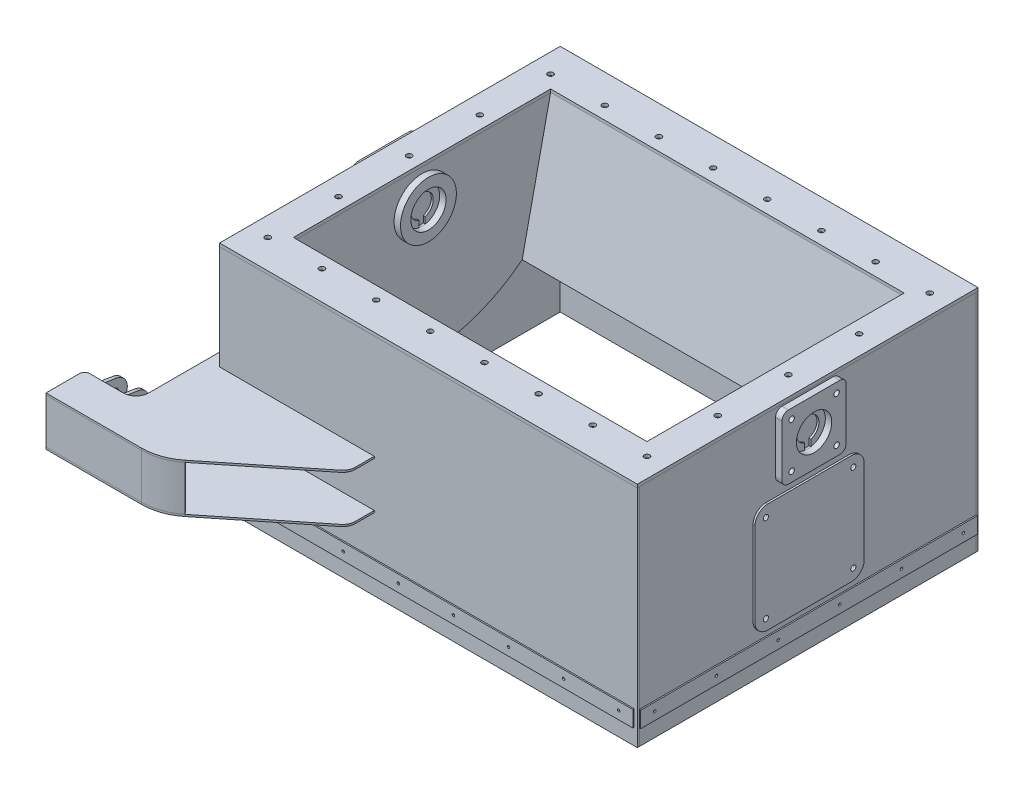
from build123d import *

# Parameters (mm, degrees)
SKETCH1_W               = 650
SKETCH1_H               = 3
BASE_FLANGE1_DEPTH      = 350
SKETCH8_W               = 3
SKETCH8_H               = 524
BASE_FLANGE2_DEPTH      = 350
SKETCH35_R              = 4
SKETCH35_W              = 120
SKETCH35_H              = 120
CUT_EXTRUDE2_DEPTH      = 3
SKETCH13_W              = 3
SKETCH13_H              = 248
BASE_FLANGE3_DEPTH      = 112.89
CUT_EXTRUDE1_DEPTH      = 3
BASE_FLANGE4_DEPTH      = 180.72
BASE_FLANGE4_DEPTH_BACK = 375.28
BASE_FLANGE5_DEPTH      = 3
CUT_EXTRUDE3_START      = -650
CUT_EXTRUDE3_DEPTH      = 650
SKETCH37_R              = 43.5
SKETCH37_R_2            = 27.5
BOSS_EXTRUDE1_DEPTH     = 10
SKETCH38_R              = 4
BOSS_EXTRUDE2_DEPTH     = 3
SKETCH39_R              = 27.5
SKETCH39_R_2            = 4.25
BOSS_EXTRUDE3_DEPTH     = 10
SKETCH42_W              = 524
SKETCH42_H              = 25
SKETCH42_R              = 2
BOSS_EXTRUDE4_DEPTH     = 2
SKETCH45_W              = 640
SKETCH45_H              = 25
SKETCH45_R              = 2
BOSS_EXTRUDE5_DEPTH     = 2
SKETCH46_W              = 650
SKETCH46_H              = 530
SKETCH46_R              = 4.25
SKETCH46_W_2            = 550
SKETCH46_H_2            = 400.16
BOSS_EXTRUDE7_DEPTH     = 5
SKETCH47_W              = 5
SKETCH47_H              = 70
BASE_FLANGE6_DEPTH      = 167
BASE_FLANGE7_START      = -70
BASE_FLANGE7_DEPTH      = 70
BASE_FLANGE8_DEPTH      = 3
FILLET1_R               = 20
FILLET2_R               = 10
BASE_FLANGE9_DEPTH      = 70
LPATTERN1_COUNT         = 2
LPATTERN1_PITCH         = 73
BASE_FLANGE10_OUTLINE_W = 5
BASE_FLANGE10_OUTLINE_H = 50
BASE_FLANGE10_DEPTH     = 60
SKETCH65_R              = 7
CUT_EXTRUDE4_DEPTH      = 5
LPATTERN2_COUNT         = 2
LPATTERN2_PITCH         = 34


# Read off the part's stored shape, not the designer's step: Base-Flange10
# Sheet-metal steps are written as plain solids
with BuildPart() as part:
    # Sketch1 → Base-Flange1 (new body)
    with BuildSketch(Plane(origin=(0, 0, 0), x_dir=(1, 0, 0), z_dir=(0, 1, 0))):
        with Locations((0, 263.5)):
            Rectangle(SKETCH1_W, SKETCH1_H)
    extrude(amount=BASE_FLANGE1_DEPTH)


with BuildPart() as body_2:
    # Mirror1: mirrored copy
    add(part.part.mirror(Plane.XY))


with BuildPart() as body_3:
    # Sketch8 → Base-Flange2 (new body)
    with BuildSketch(Plane(origin=(0, 0, 0), x_dir=(1, 0, 0), z_dir=(0, 1, 0))):
        with Locations((323.5, 0)):
            Rectangle(SKETCH8_W, SKETCH8_H)
    extrude(amount=BASE_FLANGE2_DEPTH)

    # Sketch35 → Cut-Extrude2 (cut)
    with BuildSketch(Plane(origin=(325, 0, 0), x_dir=(0, 0, -1), z_dir=(1, 0, 0))):
        with Locations((-68, 213)):
            Circle(SKETCH35_R)
        with Locations((68, 213)):
            Circle(SKETCH35_R)
        with Locations((68, 77)):
            Circle(SKETCH35_R)
        with Locations((-68, 77)):
            Circle(SKETCH35_R)
        with Locations((0, 145)):
            Rectangle(SKETCH35_W, SKETCH35_H)
    extrude(amount=-CUT_EXTRUDE2_DEPTH, mode=Mode.SUBTRACT)


with BuildPart() as body_4:
    # Mirror2: mirrored copy
    add(body_3.part.mirror(Plane(origin=(0, 0, 0), x_dir=(0, 0, 1), z_dir=(1, 0, 0))))


with BuildPart() as body_5:
    # Sketch13 → Base-Flange3 (new body)
    with BuildSketch(Plane(origin=(0, 0, 262), x_dir=(-1, 0, 0), z_dir=(0, 0, -1))):
        with Locations((95.78, 226)):
            Rectangle(SKETCH13_W, SKETCH13_H)
    extrude(amount=BASE_FLANGE3_DEPTH)

    # Sketch16 → Cut-Extrude1 (cut)
    with BuildSketch(Plane(origin=(-94.28, 0, 0), x_dir=(0, 0, -1), z_dir=(1, 0, 0))):
        with BuildLine():
            Line((-203.08, 350), (-153.068451162, 120.18965885))
            ThreePointArc((-153.068451162, 120.18965885), (-156.045395745, 107.588434847), (-167.725397516, 102))
            Line((-167.725397516, 102), (-149.11, 102))
            Line((-149.11, 102), (-149.11, 350))
            Line((-149.11, 350), (-203.08, 350))
        make_face()
    extrude(amount=-CUT_EXTRUDE1_DEPTH, mode=Mode.SUBTRACT)


with BuildPart() as body_6:
    # Sketch19 → Base-Flange4 (new, two sides: drawn at the far end of the back side and taken through both)
    with BuildSketch(Plane.ZY.offset(97.28).offset(-BASE_FLANGE4_DEPTH_BACK)):
        Polygon((203.08, 350), (158.782690886, 146.447421526), (155.851301615, 147.085353296), (200.148610729, 350.63793177), align=None)
    extrude(amount=BASE_FLANGE4_DEPTH + BASE_FLANGE4_DEPTH_BACK)


with BuildPart() as body_7:
    # Mirror3: mirrored copy
    add(body_6.part.mirror(Plane.XY))


with BuildPart() as body_8:
    # Sketch30 → Base-Flange5 (new body)
    with BuildSketch(Plane.ZY.offset(278)):
        with BuildLine():
            Line((-200.148610729, 350.63793177), (-155.851301615, 147.085353296))
            ThreePointArc((-155.851301615, 147.085353296), (0, 92.560087686), (155.851301615, 147.085353296))
            Line((155.851301615, 147.085353296), (200.148610729, 350.63793177))
            Line((200.148610729, 350.63793177), (-200.148610729, 350.63793177))
        make_face()
    extrude(amount=-BASE_FLANGE5_DEPTH)


with BuildPart() as body_9:
    # Mirror4: mirrored copy
    add(body_8.part.mirror(Plane(origin=(0, 0, 0), x_dir=(0, 0, 1), z_dir=(1, 0, 0))))


with BuildPart() as cut_extrude3_tool:
    # Sketch36 → Cut-Extrude3 (new body)
    with BuildSketch(Plane(origin=(325, 0, 0), x_dir=(0, 0, -1), z_dir=(1, 0, 0)).offset(CUT_EXTRUDE3_START)):
        with BuildLine():
            Line((-5, 324.541634566), (-5, 314.270509831))
            ThreePointArc((-5, 314.270509831), (-17.5, 297.5), (-5, 280.729490169))
            Line((-5, 280.729490169), (-5, 270.458365434))
            ThreePointArc((-5, 270.458365434), (0, 270), (5, 270.458365434))
            Line((5, 270.458365434), (5, 280.729490169))
            ThreePointArc((5, 280.729490169), (17.5, 297.5), (5, 314.270509831))
            Line((5, 314.270509831), (5, 324.541634566))
            ThreePointArc((5, 324.541634566), (0, 325), (-5, 324.541634566))
        make_face()
    extrude(amount=CUT_EXTRUDE3_DEPTH)


with BuildPart() as body_3_1:
    add(body_3.part)

    # Cut-Extrude3: cut by cut_extrude3_tool
    add(cut_extrude3_tool.part, mode=Mode.SUBTRACT)


with BuildPart() as body_4_1:
    add(body_4.part)

    # Cut-Extrude3: cut by cut_extrude3_tool
    add(cut_extrude3_tool.part, mode=Mode.SUBTRACT)


with BuildPart() as body_8_1:
    add(body_8.part)

    # Cut-Extrude3: cut by cut_extrude3_tool
    add(cut_extrude3_tool.part, mode=Mode.SUBTRACT)


with BuildPart() as body_9_1:
    add(body_9.part)

    # Cut-Extrude3: cut by cut_extrude3_tool
    add(cut_extrude3_tool.part, mode=Mode.SUBTRACT)


with BuildPart() as body_10:
    # Sketch37 → Boss-Extrude1 (new body)
    with BuildSketch(Plane(origin=(-275, 0, 0), x_dir=(0, 0, -1), z_dir=(1, 0, 0))):
        with Locations((0, 297.5)):
            Circle(SKETCH37_R)
        with Locations((0, 297.5)):
            Circle(SKETCH37_R_2, mode=Mode.SUBTRACT)
    extrude(amount=BOSS_EXTRUDE1_DEPTH)


with BuildPart() as body_11:
    # Sketch38 → Boss-Extrude2 (new body)
    with BuildSketch(Plane.ZY.offset(325)):
        with BuildLine():
            Line((-65, 230), (65, 230))
            ThreePointArc((65, 230), (79.142135624, 224.142135624), (85, 210))
            Line((85, 210), (85, 80))
            ThreePointArc((85, 80), (79.142135624, 65.857864376), (65, 60))
            Line((65, 60), (-65, 60))
            ThreePointArc((-65, 60), (-79.142135624, 65.857864376), (-85, 80))
            Line((-85, 80), (-85, 210))
            ThreePointArc((-85, 210), (-79.142135624, 224.142135624), (-65, 230))
        make_face()
        with Locations((68, 213)):
            Circle(SKETCH38_R, mode=Mode.SUBTRACT)
        with Locations((68, 77)):
            Circle(SKETCH38_R, mode=Mode.SUBTRACT)
        with Locations((-68, 77)):
            Circle(SKETCH38_R, mode=Mode.SUBTRACT)
        with Locations((-68, 213)):
            Circle(SKETCH38_R, mode=Mode.SUBTRACT)
    extrude(amount=BOSS_EXTRUDE2_DEPTH)


with BuildPart() as body_12:
    # Sketch39 → Boss-Extrude3 (new body)
    with BuildSketch(Plane.ZY.offset(325)):
        with BuildLine():
            Line((-40, 347.5), (40, 347.5))
            ThreePointArc((40, 347.5), (47.071067812, 344.571067812), (50, 337.5))
            Line((50, 337.5), (50, 257.5))
            ThreePointArc((50, 257.5), (47.071067812, 250.428932188), (40, 247.5))
            Line((40, 247.5), (-40, 247.5))
            ThreePointArc((-40, 247.5), (-47.071067812, 250.428932188), (-50, 257.5))
            Line((-50, 257.5), (-50, 337.5))
            ThreePointArc((-50, 337.5), (-47.071067812, 344.571067812), (-40, 347.5))
        make_face()
        with Locations((0, 297.5)):
            Circle(SKETCH39_R, mode=Mode.SUBTRACT)
        with Locations((-35, 332.5)):
            Circle(SKETCH39_R_2, mode=Mode.SUBTRACT)
        with Locations((-35, 262.5)):
            Circle(SKETCH39_R_2, mode=Mode.SUBTRACT)
        with Locations((35, 262.5)):
            Circle(SKETCH39_R_2, mode=Mode.SUBTRACT)
        with Locations((35, 332.5)):
            Circle(SKETCH39_R_2, mode=Mode.SUBTRACT)
    extrude(amount=BOSS_EXTRUDE3_DEPTH)


with BuildPart() as body_13:
    # Sketch42 → Boss-Extrude4 (new body)
    with BuildSketch(Plane.ZY.offset(325)):
        with Locations((0, 37.5)):
            Rectangle(SKETCH42_W, SKETCH42_H)
        with Locations((-240, 37.5)):
            Circle(SKETCH42_R, mode=Mode.SUBTRACT)
        with Locations((-144, 37.5)):
            Circle(SKETCH42_R, mode=Mode.SUBTRACT)
        with Locations((-48, 37.5)):
            Circle(SKETCH42_R, mode=Mode.SUBTRACT)
        with Locations((48, 37.5)):
            Circle(SKETCH42_R, mode=Mode.SUBTRACT)
        with Locations((144, 37.5)):
            Circle(SKETCH42_R, mode=Mode.SUBTRACT)
        with Locations((240, 37.5)):
            Circle(SKETCH42_R, mode=Mode.SUBTRACT)
    extrude(amount=BOSS_EXTRUDE4_DEPTH)


with BuildPart() as body_14:
    # Mirror5: mirrored copy
    add(body_12.part.mirror(Plane(origin=(0, 0, 0), x_dir=(0, 0, 1), z_dir=(1, 0, 0))))


with BuildPart() as body_15:
    # Mirror5 2: mirrored copy
    add(body_11.part.mirror(Plane(origin=(0, 0, 0), x_dir=(0, 0, 1), z_dir=(1, 0, 0))))


with BuildPart() as body_16:
    # Mirror5 3: mirrored copy
    add(body_13.part.mirror(Plane(origin=(0, 0, 0), x_dir=(0, 0, 1), z_dir=(1, 0, 0))))


with BuildPart() as body_17:
    # Mirror5 4: mirrored copy
    add(body_10.part.mirror(Plane(origin=(0, 0, 0), x_dir=(0, 0, 1), z_dir=(1, 0, 0))))


with BuildPart() as body_18:
    # Sketch45 → Boss-Extrude5 (new body)
    with BuildSketch(Plane(origin=(0, 0, -265), x_dir=(-1, 0, 0), z_dir=(0, 0, -1))):
        with Locations((0, 37.5)):
            Rectangle(SKETCH45_W, SKETCH45_H)
        with Locations((-298, 37.5)):
            Circle(SKETCH45_R, mode=Mode.SUBTRACT)
        with Locations((-212.29, 37.5)):
            Circle(SKETCH45_R, mode=Mode.SUBTRACT)
        with Locations((-126.58, 37.5)):
            Circle(SKETCH45_R, mode=Mode.SUBTRACT)
        with Locations((-40.87, 37.5)):
            Circle(SKETCH45_R, mode=Mode.SUBTRACT)
        with Locations((44.84, 37.5)):
            Circle(SKETCH45_R, mode=Mode.SUBTRACT)
        with Locations((130.55, 37.5)):
            Circle(SKETCH45_R, mode=Mode.SUBTRACT)
        with Locations((216.26, 37.5)):
            Circle(SKETCH45_R, mode=Mode.SUBTRACT)
        with Locations((301.97, 37.5)):
            Circle(SKETCH45_R, mode=Mode.SUBTRACT)
    extrude(amount=BOSS_EXTRUDE5_DEPTH)


with BuildPart() as body_19:
    # Mirror8: mirrored copy
    add(body_18.part.mirror(Plane.XY))


with BuildPart() as body_20:
    # Sketch46 → Boss-Extrude7 (new body)
    with BuildSketch(Plane(origin=(0, 350, 0), x_dir=(1, 0, 0), z_dir=(0, 1, 0))):
        Rectangle(SKETCH46_W, SKETCH46_H)
        with Locations(Location((295, -220, 0), (0, 0, 270))):
            Circle(SKETCH46_R, mode=Mode.SUBTRACT)
        with Locations(Location((210.71, -220, 0), (0, 0, 270))):
            Circle(SKETCH46_R, mode=Mode.SUBTRACT)
        with Locations(Location((126.42, -220, 0), (0, 0, 270))):
            Circle(SKETCH46_R, mode=Mode.SUBTRACT)
        with Locations(Location((42.13, -220, 0), (0, 0, 270))):
            Circle(SKETCH46_R, mode=Mode.SUBTRACT)
        with Locations(Location((-42.16, -220, 0), (0, 0, 270))):
            Circle(SKETCH46_R, mode=Mode.SUBTRACT)
        with Locations(Location((-126.45, -220, 0), (0, 0, 270))):
            Circle(SKETCH46_R, mode=Mode.SUBTRACT)
        with Locations(Location((-210.74, -220, 0), (0, 0, 270))):
            Circle(SKETCH46_R, mode=Mode.SUBTRACT)
        with Locations(Location((210.71, 220, 0), (0, 0, 270))):
            Circle(SKETCH46_R, mode=Mode.SUBTRACT)
        with Locations(Location((126.42, 220, 0), (0, 0, 270))):
            Circle(SKETCH46_R, mode=Mode.SUBTRACT)
        with Locations(Location((42.13, 220, 0), (0, 0, 270))):
            Circle(SKETCH46_R, mode=Mode.SUBTRACT)
        with Locations(Location((-42.16, 220, 0), (0, 0, 270))):
            Circle(SKETCH46_R, mode=Mode.SUBTRACT)
        with Locations(Location((-126.45, 220, 0), (0, 0, 270))):
            Circle(SKETCH46_R, mode=Mode.SUBTRACT)
        with Locations(Location((-210.74, 220, 0), (0, 0, 270))):
            Circle(SKETCH46_R, mode=Mode.SUBTRACT)
        with Locations(Location((-295.03, 220, 0), (0, 0, 270))):
            Circle(SKETCH46_R, mode=Mode.SUBTRACT)
        with Locations(Location((295, 220, 0), (0, 0, 270))):
            Circle(SKETCH46_R, mode=Mode.SUBTRACT)
        with Locations(Location((-295, -220, 0), (0, 0, 270))):
            Circle(SKETCH46_R, mode=Mode.SUBTRACT)
        with Locations(Location((-295, -110, 0), (0, 0, 270))):
            Circle(SKETCH46_R, mode=Mode.SUBTRACT)
        with Locations(Location((-295, 0, 0), (0, 0, 270))):
            Circle(SKETCH46_R, mode=Mode.SUBTRACT)
        with Locations(Location((-295, 110, 0), (0, 0, 270))):
            Circle(SKETCH46_R, mode=Mode.SUBTRACT)
        with Locations(Location((295, -110, 0), (0, 0, 270))):
            Circle(SKETCH46_R, mode=Mode.SUBTRACT)
        with Locations(Location((295, 0, 0), (0, 0, 270))):
            Circle(SKETCH46_R, mode=Mode.SUBTRACT)
        with Locations(Location((295, 110, 0), (0, 0, 270))):
            Circle(SKETCH46_R, mode=Mode.SUBTRACT)
        Rectangle(SKETCH46_W_2, SKETCH46_H_2, mode=Mode.SUBTRACT)
    extrude(amount=BOSS_EXTRUDE7_DEPTH)


with BuildPart() as body_21:
    # Sketch47 → Base-Flange6 (new body)
    with BuildSketch(Plane.XY.offset(265)):
        with Locations((-322.5, 150)):
            Rectangle(SKETCH47_W, SKETCH47_H)
    extrude(amount=BASE_FLANGE6_DEPTH)


with BuildPart() as body_22:
    # Sketch51 → Base-Flange7 (new body)
    with BuildSketch(Plane.XZ.offset(-115).offset(BASE_FLANGE7_START)):
        with BuildLine():
            Line((-325, 375), (-417, 375))
            ThreePointArc((-417, 375), (-422.656854249, 377.343145751), (-425, 383))
            Line((-425, 383), (-425, 432))
            Line((-425, 432), (-422, 432))
            Line((-422, 432), (-422, 383))
            ThreePointArc((-422, 383), (-420.535533906, 379.464466094), (-417, 378))
            Line((-417, 378), (-325, 378))
            Line((-325, 378), (-325, 375))
        make_face()
    extrude(amount=BASE_FLANGE7_DEPTH)


with BuildPart() as body_23:
    # Sketch54 → Base-Flange8 (new body)
    with BuildSketch(Plane.XZ.offset(-115)):
        with BuildLine():
            Line((-325, 265), (-84.28, 265))
            Line((-84.28, 265), (-84.28, 294.380173257))
            ThreePointArc((-84.28, 294.380173257), (-86.256515056, 303.04931338), (-91.795399048, 310.004984906))
            Line((-91.795399048, 310.004984906), (-226.327339539, 417.499246597))
            ThreePointArc((-226.327339539, 417.499246597), (-249.807660722, 430.498144771), (-276.265743346, 435))
            Line((-276.265743346, 435), (-425, 435))
            Line((-425, 435), (-425, 432))
            Line((-425, 432), (-425, 383))
            ThreePointArc((-425, 383), (-422.656854249, 377.343145751), (-417, 375))
            Line((-417, 375), (-345, 375))
            Line((-345, 375), (-345, 215))
            Line((-345, 215), (-325, 215))
            Line((-325, 215), (-325, 265))
        make_face()
    extrude(amount=BASE_FLANGE8_DEPTH)

    # Fillet1
    fillet1_edges = [body_23.edges().sort_by_distance(p)[0] for p in [
        (-345, 113.5, 375),
    ]]
    fillet(fillet1_edges, radius=FILLET1_R)

    # Fillet2
    fillet2_edges = [body_23.edges().sort_by_distance(p)[0] for p in [
        (-345, 113.5, 215),
    ]]
    fillet(fillet2_edges, radius=FILLET2_R)


with BuildPart() as body_24:
    # Sketch57 → Base-Flange9 (new body)
    with BuildSketch(Plane(origin=(0, 115, 0), x_dir=(1, 0, 0), z_dir=(0, 1, 0))):
        with BuildLine():
            Line((-425, -435), (-276.265743346, -435))
            ThreePointArc((-276.265743346, -435), (-249.807660722, -430.498144771), (-226.327339539, -417.499246597))
            Line((-226.327339539, -417.499246597), (-228.200029681, -415.15552485))
            ThreePointArc((-228.200029681, -415.15552485), (-250.799838821, -427.666964342), (-276.265743346, -432))
            Line((-276.265743346, -432), (-425, -432))
            Line((-425, -432), (-425, -435))
        make_face()
    extrude(amount=BASE_FLANGE9_DEPTH)


with BuildPart() as lpattern1_1:
    # LPattern1: pattern copy
    add(body_23.part.moved(Location(Vector(0, 1, 0) * (1 * LPATTERN1_PITCH))))


with BuildPart() as body_26:
    # Base-Flange10 outline → Base-Flange10 (new body)
    with BuildSketch(Plane(origin=(0, 0, 375), x_dir=(-1, 0, 0), z_dir=(0, 0, -1))):
        with Locations((411, 150)):
            Rectangle(BASE_FLANGE10_OUTLINE_W, BASE_FLANGE10_OUTLINE_H)
    extrude(amount=BASE_FLANGE10_DEPTH)

    # Sketch65 → Cut-Extrude4 (cut)
    with BuildSketch(Plane.ZY.offset(413.5)):
        with Locations((345, 150)):
            Circle(SKETCH65_R)
        with BuildLine():
            Line((375, 175), (315, 175))
            Line((315, 175), (315, 125))
            Line((315, 125), (375, 125))
            Line((375, 125), (341.871796832, 130.246156198))
            ThreePointArc((341.871796832, 130.246156198), (325, 150), (341.871796832, 169.753843802))
            Line((341.871796832, 169.753843802), (375, 175))
        make_face()
    extrude(amount=-CUT_EXTRUDE4_DEPTH, mode=Mode.SUBTRACT)


with BuildPart() as lpattern2_1:
    # LPattern2: pattern copy
    add(body_26.part.moved(Location(Vector(1, 0, 0) * (1 * LPATTERN2_PITCH))))


solid = Compound([part.part, body_2.part, body_5.part, body_6.part, body_7.part, body_3_1.part, body_4_1.part, body_8_1.part, body_9_1.part, body_10.part, body_11.part, body_12.part, body_13.part, body_14.part, body_15.part, body_16.part, body_17.part, body_18.part, body_19.part, body_20.part, body_21.part, body_22.part, body_23.part, body_24.part, lpattern1_1.part, body_26.part, lpattern2_1.part])
